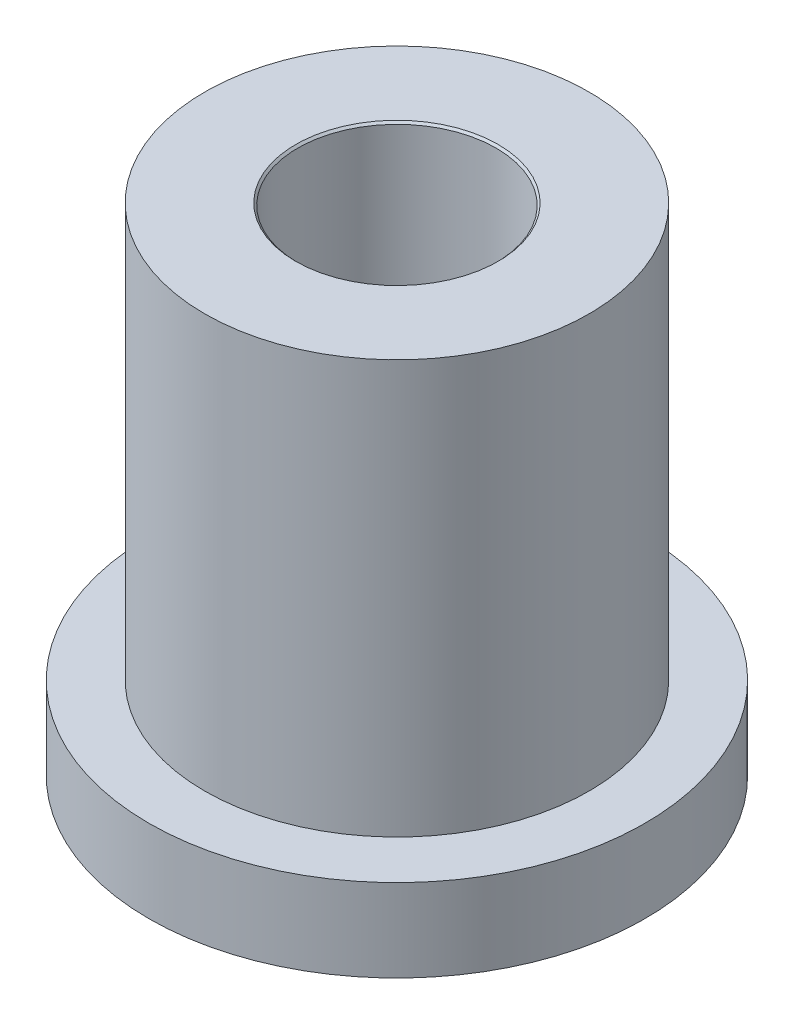
from build123d import *

# Parameters (mm, degrees)
SKETCH1_R                      = 3
BOSS_EXTRUDE1_DEPTH            = 1
SKETCH2_R                      = 2.325
BOSS_EXTRUDE2_DEPTH            = 5
M2_CLEARANCE_HOLE1_D           = 2.4
M2_CLEARANCE_HOLE1_CSINK_D     = 2.45
M2_CLEARANCE_HOLE1_CSINK_ANGLE = 90


with BuildPart() as part:
    # Sketch1 → Boss-Extrude1 (new body)
    with BuildSketch(Plane(origin=(0, 0, 0), x_dir=(1, 0, 0), z_dir=(0, 1, 0))):
        Circle(SKETCH1_R)
    extrude(amount=BOSS_EXTRUDE1_DEPTH)

    # Sketch2 → Boss-Extrude2 (add)
    with BuildSketch(Plane(origin=(0, 1, 0), x_dir=(1, 0, 0), z_dir=(0, 1, 0))):
        Circle(SKETCH2_R)
    extrude(amount=BOSS_EXTRUDE2_DEPTH)

    # M2 Clearance Hole1 (through all)
    with Locations(Plane(origin=(0, 6, 0), x_dir=(1, 0, 0), z_dir=(0, 1, 0))):
        with Locations((0, 0)):
            CounterSinkHole(M2_CLEARANCE_HOLE1_D / 2, M2_CLEARANCE_HOLE1_CSINK_D / 2, counter_sink_angle=M2_CLEARANCE_HOLE1_CSINK_ANGLE)


solid = part.part
